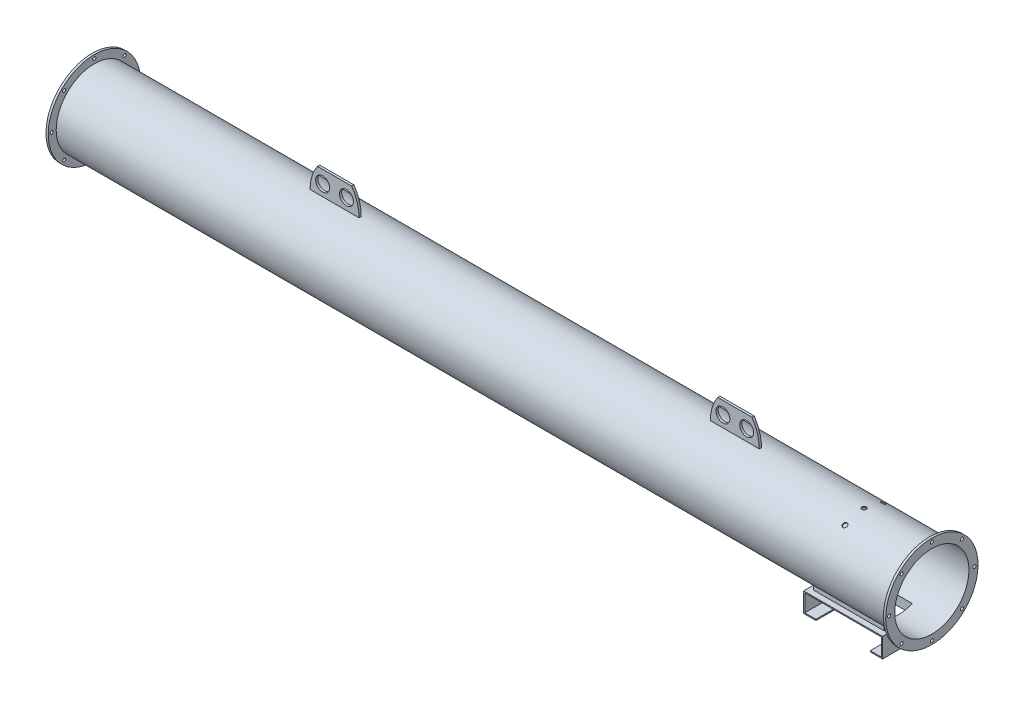
from build123d import *

# Parameters (mm, degrees)
SKIZZE1_W                         = 3000
SKIZZE1_H                         = 4
AUFSATZ_LINEAR_START              = -8
SKIZZE2_R                         = 165
SKIZZE2_R_2                       = 136.5
AUFSATZ_LINEAR_AUSTRAGEN1_DEPTH   = 8
SKIZZE3_R                         = 165
SKIZZE3_R_2                       = 136.5
AUFSATZ_LINEAR_AUSTRAGEN2_DEPTH   = 8
DURCHGANGSLOCH_F_R_M101_D         = 11
DURCHGANGSLOCH_F_R_M101_DEPTH     = 8.001
DURCHGANGSLOCH_F_R_M102_D         = 11
KREISMUSTER1_COUNT                = 8
SKIZZE13_R                        = 25
AUFSATZ_LINEAR_AUSTRAGEN4_DEPTH   = 4
LINEARES_MUSTER2_COUNT            = 2
LINEARES_MUSTER2_PITCH            = 1430
SKIZZE14_W                        = 244
SKIZZE14_H                        = 100
SCHNITT_LINEAR_AUSTRAGEN4_DEPTH   = 3013.687711994
AUFSATZ_LINEAR_AUSTRAGEN5_DEPTH   = 75
AUFSATZ_LINEAR_AUSTRAGEN5_2_DEPTH = 75
SKIZZE18_W                        = 252
SKIZZE18_H                        = 16
SCHNITT_LINEAR_AUSTRAGEN5_DEPTH   = 25
SKIZZE19_W                        = 252
SKIZZE19_H                        = 16
SCHNITT_LINEAR_AUSTRAGEN6_DEPTH   = 25
AUFSATZ_LINEAR_START_2            = -368
AUFSATZ_LINEAR_AUSTRAGEN6_DEPTH   = 4
AUFSATZ_LINEAR_START_3            = -120
AUFSATZ_LINEAR_AUSTRAGEN6_2_DEPTH = 4
AUFSATZ_LINEAR_AUSTRAGEN10_DEPTH  = 5
SKIZZE21_W                        = 20
SKIZZE21_H                        = 4
AUFSATZ_LINEAR_AUSTRAGEN11_DEPTH  = 244
SCHNITT_LINEAR_AUSTRAGEN7_REACH   = 2914.204
KREISMUSTER2_COUNT                = 3
KREISMUSTER2_ANGLE                = 60


# Read off the part's stored shape, not the designer's step: Aufsatz-Linear austragen6
with BuildPart() as part:
    # Skizze1 → Rotation1 (revolve)
    with BuildSketch(Plane.XY):
        with Locations((-1500, 134.5)):
            Rectangle(SKIZZE1_W, SKIZZE1_H)
    revolve(axis=Axis((10, 0, 0), (-1, 0, 0)))

    # Skizze2 → Aufsatz-Linear austragen1 (add)
    with BuildSketch(Plane(origin=(0, 0, 0), x_dir=(0, 0, -1), z_dir=(1, 0, 0)).offset(AUFSATZ_LINEAR_START)):
        with Locations(Location((0, 0, 0), (0, 0, 90))):
            Circle(SKIZZE2_R)
        with Locations(Location((0, 0, 0), (0, 0, 90))):
            Circle(SKIZZE2_R_2, mode=Mode.SUBTRACT)
    extrude(amount=AUFSATZ_LINEAR_AUSTRAGEN1_DEPTH)

    # Skizze3 → Aufsatz-Linear austragen2 (add)
    with BuildSketch(Plane.ZY.offset(3000)):
        with Locations(Location((0, 0, 0), (0, 0, 90))):
            Circle(SKIZZE3_R)
        with Locations(Location((0, 0, 0), (0, 0, 90))):
            Circle(SKIZZE3_R_2, mode=Mode.SUBTRACT)
    extrude(amount=-AUFSATZ_LINEAR_AUSTRAGEN2_DEPTH)

    # Durchgangsloch für M101
    with Locations(Plane(origin=(0, 0, 0), x_dir=(0, 0, -1), z_dir=(1, 0, 0))):
        with Locations((0, 152.5)):
            durchgangsloch_f_r_m101 = Hole(DURCHGANGSLOCH_F_R_M101_D / 2, depth=DURCHGANGSLOCH_F_R_M101_DEPTH)

    # Durchgangsloch für M102 (through all)
    with Locations(Plane.ZY.offset(3000)):
        with Locations((0, 152.5)):
            durchgangsloch_f_r_m102 = Hole(DURCHGANGSLOCH_F_R_M102_D / 2)

    # Kreismuster1: Durchgangsloch für M101, Durchgangsloch für M102 ×8 about axis
    kreismuster1_axis = Axis((0, 0, 0), (1, 0, 0))
    add([durchgangsloch_f_r_m101.rotate(kreismuster1_axis, i * 360 / KREISMUSTER1_COUNT) for i in range(1, KREISMUSTER1_COUNT)], mode=Mode.SUBTRACT)
    add([durchgangsloch_f_r_m102.rotate(kreismuster1_axis, i * 360 / KREISMUSTER1_COUNT) for i in range(1, KREISMUSTER1_COUNT)], mode=Mode.SUBTRACT)

    # Skizze14 → Schnitt-Linear austragen4 (cut, through all)
    with BuildSketch(Plane(origin=(0, 0, 0), x_dir=(1, 0, 0), z_dir=(0, 1, 0))):
        with Locations((-242, 0)):
            Rectangle(SKIZZE14_W, SKIZZE14_H)
    extrude(amount=-SCHNITT_LINEAR_AUSTRAGEN4_DEPTH, mode=Mode.SUBTRACT)



with BuildPart() as body_2:
    # Skizze13 → Aufsatz-Linear austragen4 (new, symmetric)
    with BuildSketch(Plane.XY):
        with BuildLine():
            Line((-787.5, 136.5), (-612.5, 136.5))
            ThreePointArc((-612.5, 136.5), (-619.254039077, 181.003872632), (-638.907929057, 221.5))
            Line((-638.907929057, 221.5), (-761.092070943, 221.5))
            ThreePointArc((-761.092070943, 221.5), (-780.745960923, 181.003872632), (-787.5, 136.5))
        make_face()
        with Locations((-742.5, 176.5)):
            Circle(SKIZZE13_R, mode=Mode.SUBTRACT)
        with Locations(Location((-657.5, 176.5, 0), (0, 0, 180))):
            Circle(SKIZZE13_R, mode=Mode.SUBTRACT)
    extrude(amount=AUFSATZ_LINEAR_AUSTRAGEN4_DEPTH, both=True)


with BuildPart() as lineares_muster2_1:
    # Lineares Muster2: pattern copy
    add(body_2.part.moved(Location(Vector(-1, 0, 0) * (1 * LINEARES_MUSTER2_PITCH))))


with BuildPart() as body_4:
    # Skizze15 → Aufsatz-Linear austragen5 (new, symmetric)
    with BuildSketch(Plane.XY):
        Polygon((-364, -136.5), (-364, -156.5), (-379, -156.5), (-379, -218.5), (-339, -218.5), (-339, -222.5), (-383, -222.5), (-383, -152.5), (-368, -152.5), (-368, -136.5), align=None)
    extrude(amount=AUFSATZ_LINEAR_AUSTRAGEN5_DEPTH, both=True)


with BuildPart() as body_5:
    # Skizze15 → Aufsatz-Linear austragen5 2 (new, symmetric)
    with BuildSketch(Plane.XY):
        Polygon((-116, -136.5), (-120, -136.5), (-120, -156.5), (-105, -156.5), (-105, -218.5), (-145, -218.5), (-145, -222.5), (-101, -222.5), (-101, -152.5), (-116, -152.5), align=None)
    extrude(amount=AUFSATZ_LINEAR_AUSTRAGEN5_2_DEPTH, both=True)


with BuildPart() as schnitt_linear_austragen5_tool:
    # Skizze18 → Schnitt-Linear austragen5 (new body)
    with BuildSketch(Plane.XY.offset(75)):
        with Locations((-242, -144.5)):
            Rectangle(SKIZZE18_W, SKIZZE18_H)
    extrude(amount=-SCHNITT_LINEAR_AUSTRAGEN5_DEPTH)


with BuildPart() as body_4_1:
    add(body_4.part)

    # Schnitt-Linear austragen5: cut by schnitt_linear_austragen5_tool
    add(schnitt_linear_austragen5_tool.part, mode=Mode.SUBTRACT)


with BuildPart() as body_5_1:
    add(body_5.part)

    # Schnitt-Linear austragen5: cut by schnitt_linear_austragen5_tool
    add(schnitt_linear_austragen5_tool.part, mode=Mode.SUBTRACT)


with BuildPart() as schnitt_linear_austragen6_tool:
    # Skizze19 → Schnitt-Linear austragen6 (new body)
    with BuildSketch(Plane(origin=(0, 0, -75), x_dir=(-1, 0, 0), z_dir=(0, 0, -1))):
        with Locations((242, -144.5)):
            Rectangle(SKIZZE19_W, SKIZZE19_H)
    extrude(amount=-SCHNITT_LINEAR_AUSTRAGEN6_DEPTH)


with BuildPart() as body_4_2:
    add(body_4_1.part)

    # Schnitt-Linear austragen6: cut by schnitt_linear_austragen6_tool
    add(schnitt_linear_austragen6_tool.part, mode=Mode.SUBTRACT)


with BuildPart() as body_5_2:
    add(body_5_1.part)

    # Schnitt-Linear austragen6: cut by schnitt_linear_austragen6_tool
    add(schnitt_linear_austragen6_tool.part, mode=Mode.SUBTRACT)


with BuildPart() as part_1:
    add(part.part)

    add(body_4_2.part)  # Aufsatz-Linear austragen6 merges body 4

    add(body_5_2.part)  # Aufsatz-Linear austragen6 merges body 5
    # Aufsatz-Linear austragen6 outline → Aufsatz-Linear austragen6 (add)
    with BuildSketch(Plane.YZ.offset(AUFSATZ_LINEAR_START_2)):
        with BuildLine():
            Line((-127.012794631, 50), (-136.5, 50))
            Line((-136.5, 50), (-136.5, -1.4e-08))
            ThreePointArc((-136.5, -1.4e-08), (-134.107226628, 25.446056003), (-127.012794631, 50))
        make_face()
        with BuildLine():
            ThreePointArc((-127.012794631, -50), (-134.107226626, -25.446056016), (-136.5, -1.4e-08))
            Line((-136.5, -1.4e-08), (-136.5, -50))
            Line((-136.5, -50), (-127.012794631, -50))
        make_face()
    extrude(amount=AUFSATZ_LINEAR_AUSTRAGEN6_DEPTH)

    # Aufsatz-Linear austragen6 2 outline → Aufsatz-Linear austragen6 2 (add)
    with BuildSketch(Plane.YZ.offset(AUFSATZ_LINEAR_START_3)):
        with BuildLine():
            Line((-127.012794631, 50), (-136.5, 50))
            Line((-136.5, 50), (-136.5, -1.4e-08))
            ThreePointArc((-136.5, -1.4e-08), (-134.107226628, 25.446056003), (-127.012794631, 50))
        make_face()
        with BuildLine():
            ThreePointArc((-127.012794631, -50), (-134.107226626, -25.446056016), (-136.5, -1.4e-08))
            Line((-136.5, -1.4e-08), (-136.5, -50))
            Line((-136.5, -50), (-127.012794631, -50))
        make_face()
    extrude(amount=AUFSATZ_LINEAR_AUSTRAGEN6_2_DEPTH)

    # Skizze17 → Aufsatz-Linear austragen10 (add)
    with BuildSketch(Plane.XY.offset(50)):
        Polygon((-368, -152.5), (-364, -152.5), (-364, -156.5), (-120, -156.5), (-120, -152.5), (-116, -152.5), (-116, -126.5), (-368, -126.5), align=None)
    aufsatz_linear_austragen10 = extrude(amount=AUFSATZ_LINEAR_AUSTRAGEN10_DEPTH)

    # Spiegeln1: Aufsatz-Linear austragen10 across plane
    add(aufsatz_linear_austragen10.mirror(Plane.XY))

    # Skizze21 → Aufsatz-Linear austragen11 (add)
    with BuildSketch(Plane(origin=(-364, 0, 0), x_dir=(0, 0, -1), z_dir=(1, 0, 0))):
        with Locations((-65, -154.5)):
            Rectangle(SKIZZE21_W, SKIZZE21_H)
        with Locations((65, -154.5)):
            Rectangle(SKIZZE21_W, SKIZZE21_H)
    extrude(amount=AUFSATZ_LINEAR_AUSTRAGEN11_DEPTH)

    # Schnitt-Linear austragen7: up to this face of the body (flat: up to its plane)
    schnitt_linear_austragen7_end = Plane(part_1.part.faces().sort_by_distance((-383, -187.5, 0))[0])
    # Skizze20 → Schnitt-Linear austragen7 (cut, up to the picked face)
    with BuildSketch(Plane(origin=(-101, 0, 0), x_dir=(0, 0, -1), z_dir=(1, 0, 0)), mode=Mode.PRIVATE) as schnitt_linear_austragen7_sk1:
        with BuildLine():
            Line((8, -172.5), (8, -202.5))
            ThreePointArc((8, -202.5), (0, -210.5), (-8, -202.5))
            Line((-8, -202.5), (-8, -172.5))
            ThreePointArc((-8, -172.5), (0, -164.5), (8, -172.5))
        make_face()
    schnitt_linear_austragen7_tool1 = split(extrude(schnitt_linear_austragen7_sk1.sketch, amount=-SCHNITT_LINEAR_AUSTRAGEN7_REACH, mode=Mode.PRIVATE), bisect_by=schnitt_linear_austragen7_end, keep=Keep.BOTH, mode=Mode.PRIVATE)
    add(schnitt_linear_austragen7_tool1.solids().sort_by(Axis((-101, -187.5, 0), (-1, 0, 0)))[0], mode=Mode.SUBTRACT)

    # Skizze22 → Schnitt-Rotation1 (revolve, cut)
    with BuildSketch(Plane(origin=(-242, 0, 0), x_dir=(0, 0, -1), z_dir=(1, 0, 0)), mode=Mode.PRIVATE) as schnitt_rotation1_sk:
        Polygon((90, 155.884572681), (60, 103.923048454), (53.07179677, 107.923048454), (83.07179677, 159.884572681), align=None)
    schnitt_rotation1 = revolve(schnitt_rotation1_sk.sketch.rotate(Axis((-242, 0, 0), (0, 0.8660254037844417, -0.4999999999999946)), 180), axis=Axis((-242, 0, 0), (0, 0.8660254037844417, -0.4999999999999946)), mode=Mode.SUBTRACT)

    # Kreismuster2: Schnitt-Rotation1 ×3 about axis
    kreismuster2_axis = Axis((0, 0, 0), (1, 0, 0))
    for i in range(1, KREISMUSTER2_COUNT):
        add(schnitt_rotation1.rotate(kreismuster2_axis, i * KREISMUSTER2_ANGLE / (KREISMUSTER2_COUNT - 1)), mode=Mode.SUBTRACT)


solid = Compound([body_2.part, lineares_muster2_1.part, part_1.part])
